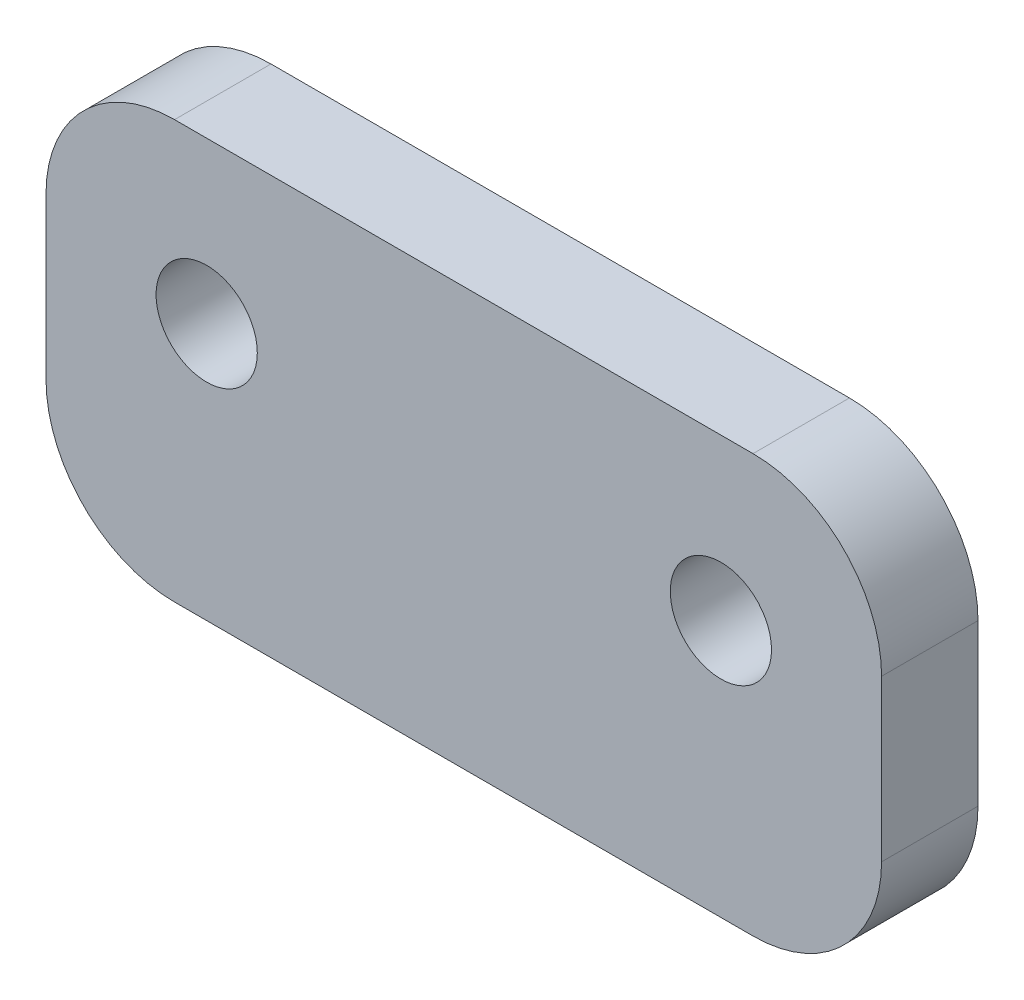
from build123d import *

# Parameters (mm, degrees)
SKETCH1_W             = 41.275
SKETCH1_H             = 20.6375
BASE_FLANGE1_DEPTH    = 4.7625
BREAK_CORNER1_DEPTH   = 4.7625
M6X1_0_TAPPED_HOLE1_D = 5


# Read off the part's stored shape, not the designer's step: Break-Corner1
# Sheet-metal steps are written as plain solids
with BuildPart() as part:
    # Sketch1 → Base-Flange1 (new body)
    with BuildSketch(Plane.XY):
        Rectangle(SKETCH1_W, SKETCH1_H)
    extrude(amount=BASE_FLANGE1_DEPTH)

    # Break-Corner1 outline → Break-Corner1 (cut)
    with BuildSketch(Plane.XY):
        with BuildLine():
            Line((-20.6375, 10.31875), (-20.6375, 3.96875))
            ThreePointArc((-20.6375, 3.96875), (-18.777628061, 8.458878061), (-14.2875, 10.31875))
            Line((-14.2875, 10.31875), (-20.6375, 10.31875))
        make_face()
        with BuildLine():
            ThreePointArc((-14.2875, -10.31875), (-18.777628061, -8.458878061), (-20.6375, -3.96875))
            Line((-20.6375, -3.96875), (-20.6375, -10.31875))
            Line((-20.6375, -10.31875), (-14.2875, -10.31875))
        make_face()
        with BuildLine():
            Line((20.6375, 10.31875), (14.2875, 10.31875))
            ThreePointArc((14.2875, 10.31875), (18.777628061, 8.458878061), (20.6375, 3.96875))
            Line((20.6375, 3.96875), (20.6375, 10.31875))
        make_face()
        with BuildLine():
            ThreePointArc((20.6375, -3.96875), (18.777628061, -8.458878061), (14.2875, -10.31875))
            Line((14.2875, -10.31875), (20.6375, -10.31875))
            Line((20.6375, -10.31875), (20.6375, -3.96875))
        make_face()
    extrude(amount=BREAK_CORNER1_DEPTH, mode=Mode.SUBTRACT)

    # M6x1.0 Tapped Hole1 (through all)
    with Locations(Plane.XY.offset(4.7625)):
        with Locations((-12.7, 2.38125), (12.7, 2.38125)):
            Hole(M6X1_0_TAPPED_HOLE1_D / 2)


solid = part.part
